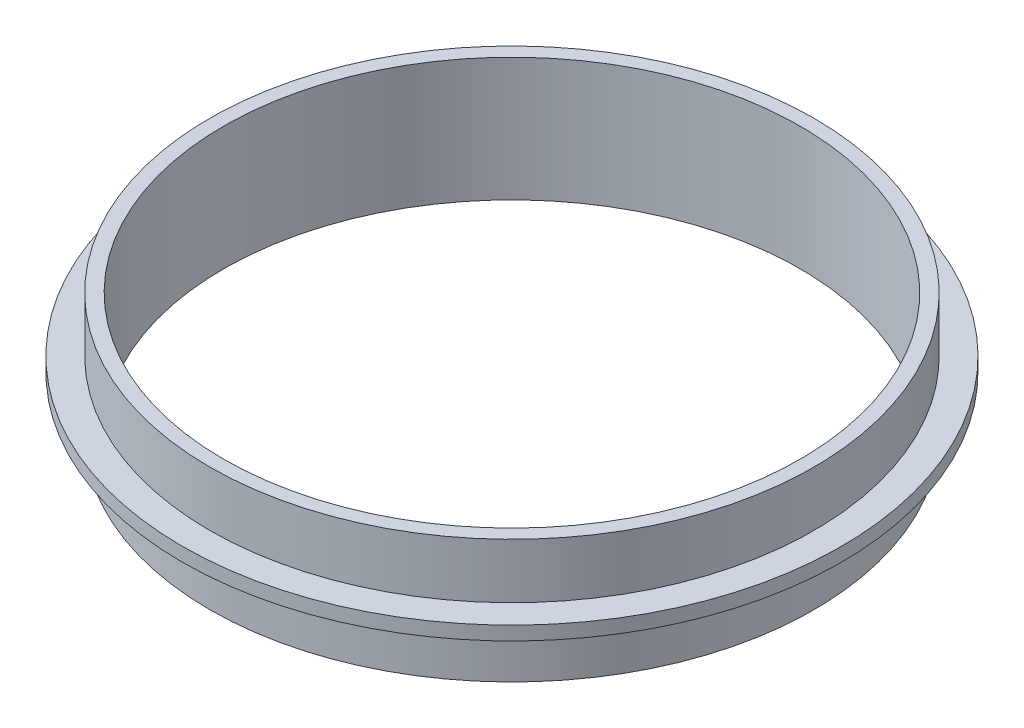
from build123d import *

# Parameters (mm, degrees)
BOSS_EXTRUDE1_DEPTH      = 3.175
BOSS_EXTRUDE1_DEPTH_BACK = 3.175
SKETCH2_R                = 152.4
SKETCH2_R_2              = 133.35
SKETCH3_R                = 139.7
SKETCH3_R_2              = 133.35
BOSS_EXTRUDE2_DEPTH      = 25.4


with BuildPart() as part:
    # Sketch2 → Boss-Extrude1 (new, two sides: drawn at the far end of the back side and taken through both)
    with BuildSketch(Plane(origin=(0, 0, 0), x_dir=(1, 0, 0), z_dir=(0, 1, 0)).offset(-BOSS_EXTRUDE1_DEPTH_BACK)):
        Circle(SKETCH2_R)
        Circle(SKETCH2_R_2, mode=Mode.SUBTRACT)
    extrude(amount=BOSS_EXTRUDE1_DEPTH + BOSS_EXTRUDE1_DEPTH_BACK)

    # Sketch3 → Boss-Extrude2 (add)
    with BuildSketch(Plane(origin=(0, 3.175, 0), x_dir=(1, 0, 0), z_dir=(0, 1, 0))):
        Circle(SKETCH3_R)
        Circle(SKETCH3_R_2, mode=Mode.SUBTRACT)
    boss_extrude2 = extrude(amount=BOSS_EXTRUDE2_DEPTH)

    # Mirror1: Boss-Extrude2 across plane
    add(boss_extrude2.mirror(Plane.ZX))


solid = part.part
